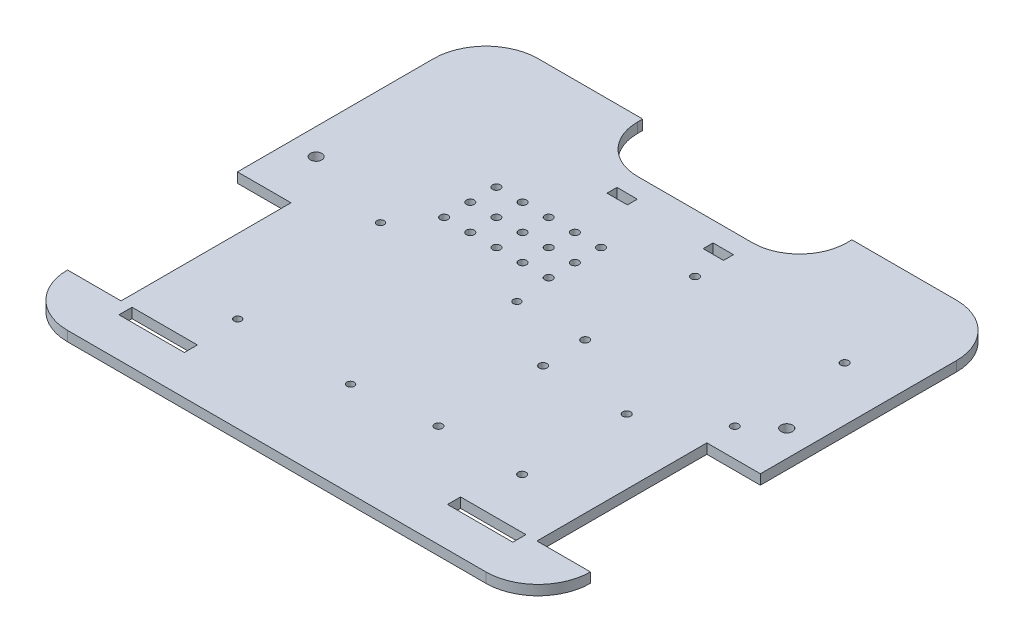
from build123d import *

# Parameters (mm, degrees)
SKETCH1_W           = 254
SKETCH1_H           = 228.6
BOSS_EXTRUDE1_DEPTH = 4.826
SKETCH2_W           = 26.00000007
SKETCH2_H           = 82.55
CUT_EXTRUDE1_DEPTH  = 4.826
CUT_EXTRUDE3_DEPTH  = 4.826
SKETCH7_W           = 101.6
SKETCH7_H           = 25.4
CUT_EXTRUDE5_DEPTH  = 4.826
FILLET9_R           = 22.86
FILLET10_R          = 22.86
CUT_EXTRUDE6_DEPTH  = 4.826
SKETCH9_W           = 31.75
SKETCH9_H           = 6.35
CUT_EXTRUDE7_DEPTH  = 171.929167423
SKETCH11_W          = 9.906
SKETCH11_H          = 4.826
CUT_EXTRUDE8_DEPTH  = 171.929167423
SKETCH13_R          = 1.905
CUT_EXTRUDE10_DEPTH = 171.929167423
SKETCH14_R          = 1.778
CUT_EXTRUDE11_DEPTH = 171.929167423
SKETCH15_R          = 1.905
CUT_EXTRUDE12_DEPTH = 171.929167423
SKETCH16_R          = 1.905
CUT_EXTRUDE13_DEPTH = 171.929167423
SKETCH17_R          = 2.778125
CUT_EXTRUDE14_DEPTH = 171.929167423


with BuildPart() as part:
    # Sketch1 → Boss-Extrude1 (new body)
    with BuildSketch(Plane(origin=(0, 0, 0), x_dir=(1, 0, 0), z_dir=(0, 1, 0))):
        Rectangle(SKETCH1_W, SKETCH1_H)
    extrude(amount=BOSS_EXTRUDE1_DEPTH)

    # Sketch2 → Cut-Extrude1 (cut)
    with BuildSketch(Plane(origin=(0, 4.826, 0), x_dir=(1, 0, 0), z_dir=(0, 1, 0))):
        with Locations((-113.999999965, -47.625)):
            Rectangle(SKETCH2_W, SKETCH2_H)
        with Locations((113.999999965, -47.625)):
            Rectangle(SKETCH2_W, SKETCH2_H)
    extrude(amount=-CUT_EXTRUDE1_DEPTH, mode=Mode.SUBTRACT)

    # Sketch4 → Cut-Extrude3 (cut)
    with BuildSketch(Plane(origin=(0, 4.826, 0), x_dir=(1, 0, 0), z_dir=(0, 1, 0))):
        with BuildLine():
            Line((-127, 88.9), (-127, 114.3))
            Line((-127, 114.3), (-101.6, 114.3))
            ThreePointArc((-101.6, 114.3), (-119.560512242, 106.860512242), (-127, 88.9))
        make_face()
        with BuildLine():
            Line((127, 88.9), (127, 114.3))
            Line((127, 114.3), (101.6, 114.3))
            ThreePointArc((101.6, 114.3), (119.560512242, 106.860512242), (127, 88.9))
        make_face()
    extrude(amount=-CUT_EXTRUDE3_DEPTH, mode=Mode.SUBTRACT)

    # Sketch7 → Cut-Extrude5 (cut)
    with BuildSketch(Plane(origin=(0, 4.826, 0), x_dir=(1, 0, 0), z_dir=(0, 1, 0))):
        with Locations((0, 101.6)):
            Rectangle(SKETCH7_W, SKETCH7_H)
    extrude(amount=-CUT_EXTRUDE5_DEPTH, mode=Mode.SUBTRACT)

    # Fillet9
    fillet9_edges = [part.edges().sort_by_distance(p)[0] for p in [
        (-50.8, 2.413, -88.9),
    ]]
    fillet(fillet9_edges, radius=FILLET9_R)

    # Fillet10
    fillet10_edges = [part.edges().sort_by_distance(p)[0] for p in [
        (50.8, 2.413, -88.9),
    ]]
    fillet(fillet10_edges, radius=FILLET10_R)

    # Sketch8 → Cut-Extrude6 (cut)
    with BuildSketch(Plane(origin=(0, 4.826, 0), x_dir=(1, 0, 0), z_dir=(0, 1, 0))):
        with BuildLine():
            Line((-127, -88.9), (-127, -114.3))
            Line((-127, -114.3), (-101.6, -114.3))
            ThreePointArc((-101.6, -114.3), (-119.560512242, -106.860512242), (-127, -88.9))
        make_face()
        with BuildLine():
            Line((127, -114.3), (101.6, -114.3))
            ThreePointArc((101.6, -114.3), (119.560512242, -106.860512242), (127, -88.9))
            Line((127, -88.9), (127, -114.3))
        make_face()
    extrude(amount=-CUT_EXTRUDE6_DEPTH, mode=Mode.SUBTRACT)

    # Sketch9 → Cut-Extrude7 (cut, through all)
    with BuildSketch(Plane.XZ):
        with Locations((-79.79099993, 92.075)):
            Rectangle(SKETCH9_W, SKETCH9_H)
        with Locations((79.79099993, 92.075)):
            Rectangle(SKETCH9_W, SKETCH9_H)
    extrude(amount=-CUT_EXTRUDE7_DEPTH, mode=Mode.SUBTRACT)

    # Sketch11 → Cut-Extrude8 (cut, through all)
    with BuildSketch(Plane(origin=(0, 4.826, 0), x_dir=(1, 0, 0), z_dir=(0, 1, 0))):
        with Locations((-23.345869789, 76.863822677)):
            Rectangle(SKETCH11_W, SKETCH11_H)
        with Locations((23.345869789, 76.863822677)):
            Rectangle(SKETCH11_W, SKETCH11_H)
    extrude(amount=-CUT_EXTRUDE8_DEPTH, mode=Mode.SUBTRACT)

    # Sketch13 → Cut-Extrude10 (cut, through all)
    with BuildSketch(Plane(origin=(0, 4.826, 0), x_dir=(1, 0, 0), z_dir=(0, 1, 0))):
        with Locations((-6.882364692, 24.715879034)):
            Circle(SKETCH13_R)
        with Locations((-19.582364692, 24.715879034)):
            Circle(SKETCH13_R)
        with Locations((-32.282364692, 24.715879034)):
            Circle(SKETCH13_R)
        with Locations((-44.982364692, 24.715879034)):
            Circle(SKETCH13_R)
        with Locations((-57.682364692, 24.715879034)):
            Circle(SKETCH13_R)
        with Locations((-19.582364692, 37.415879034)):
            Circle(SKETCH13_R)
        with Locations((-32.282364692, 37.415879034)):
            Circle(SKETCH13_R)
        with Locations((-44.982364692, 37.415879034)):
            Circle(SKETCH13_R)
        with Locations((-57.682364692, 37.415879034)):
            Circle(SKETCH13_R)
        with Locations((-19.582364692, 50.115879034)):
            Circle(SKETCH13_R)
        with Locations((-32.282364692, 50.115879034)):
            Circle(SKETCH13_R)
        with Locations((-44.982364692, 50.115879034)):
            Circle(SKETCH13_R)
        with Locations((-57.682364692, 50.115879034)):
            Circle(SKETCH13_R)
        with Locations((-6.882364692, 37.415879034)):
            Circle(SKETCH13_R)
        with Locations((-6.882364692, 50.115879034)):
            Circle(SKETCH13_R)
    extrude(amount=-CUT_EXTRUDE10_DEPTH, mode=Mode.SUBTRACT)

    # Sketch14 → Cut-Extrude11 (cut, through all)
    with BuildSketch(Plane(origin=(0, 4.826, 0), x_dir=(1, 0, 0), z_dir=(0, 1, 0))):
        with Locations((-65.048364692, -68.196408989)):
            Circle(SKETCH14_R)
        with Locations((-10.184364692, -68.196408989)):
            Circle(SKETCH14_R)
        with Locations((-70.890364692, 6.987591011)):
            Circle(SKETCH14_R)
        with Locations((-4.596364692, 6.987591011)):
            Circle(SKETCH14_R)
    extrude(amount=-CUT_EXTRUDE11_DEPTH, mode=Mode.SUBTRACT)

    # Sketch15 → Cut-Extrude12 (cut, through all)
    with BuildSketch(Plane(origin=(0, 4.826, 0), x_dir=(1, 0, 0), z_dir=(0, 1, 0))):
        with Locations((69.413857942, -64.485146072)):
            Circle(SKETCH15_R)
        with Locations((28.773857942, -64.485146072)):
            Circle(SKETCH15_R)
        with Locations((69.413857942, -13.685146072)):
            Circle(SKETCH15_R)
        with Locations((28.773857942, -13.685146072)):
            Circle(SKETCH15_R)
    extrude(amount=-CUT_EXTRUDE12_DEPTH, mode=Mode.SUBTRACT)

    # Sketch16 → Cut-Extrude13 (cut, through all)
    with BuildSketch(Plane(origin=(0, 4.826, 0), x_dir=(1, 0, 0), z_dir=(0, 1, 0))):
        with Locations((100.782857942, 7.422707891)):
            Circle(SKETCH16_R)
        with Locations((28.138857942, 7.422707891)):
            Circle(SKETCH16_R)
        with Locations((28.138857942, 60.762707891)):
            Circle(SKETCH16_R)
        with Locations((100.782857942, 60.762707891)):
            Circle(SKETCH16_R)
    extrude(amount=-CUT_EXTRUDE13_DEPTH, mode=Mode.SUBTRACT)

    # Sketch17 → Cut-Extrude14 (cut, through all)
    with BuildSketch(Plane.XZ):
        with Locations((114.3, -19.164632523)):
            Circle(SKETCH17_R)
        with Locations((-114.3, -19.164632523)):
            Circle(SKETCH17_R)
    extrude(amount=-CUT_EXTRUDE14_DEPTH, mode=Mode.SUBTRACT)


solid = part.part
